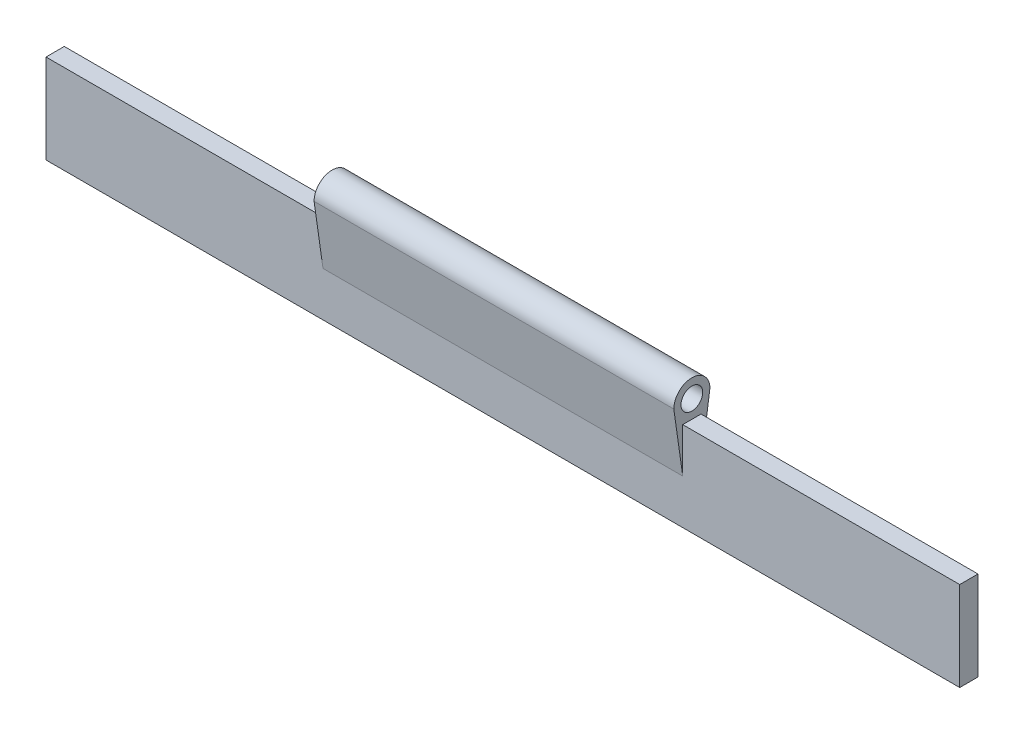
from build123d import *

# Parameters (mm, degrees)
SKETCH1_W           = 127
SKETCH1_H           = 12.4
BOSS_EXTRUDE1_DEPTH = 2.54
SKETCH2_R           = 1.51
BOSS_EXTRUDE3_DEPTH = 25
BOSS_EXTRUDE4_START = -25
SKETCH2_2_R         = 1.51
BOSS_EXTRUDE4_DEPTH = 25


with BuildPart() as part:
    # Sketch1 → Boss-Extrude1 (new body)
    with BuildSketch(Plane.XY):
        with Locations((0, 6.2)):
            Rectangle(SKETCH1_W, SKETCH1_H)
    extrude(amount=BOSS_EXTRUDE1_DEPTH)

    # Sketch2 → Boss-Extrude3 (add)
    with BuildSketch(Plane(origin=(0, 0, 0), x_dir=(0, 0, -1), z_dir=(1, 0, 0))):
        with BuildLine():
            Line((-2.54, 6.2), (-3.78, 14.9))
            ThreePointArc((-3.78, 14.9), (-1.27, 17.41), (1.24, 14.9))
            Line((1.24, 14.9), (0, 6.2))
            Line((0, 6.2), (-2.54, 6.2))
        make_face()
        with Locations((-1.27, 14.9)):
            Circle(SKETCH2_R, mode=Mode.SUBTRACT)
    extrude(amount=BOSS_EXTRUDE3_DEPTH)

    # Sketch2<2> → Boss-Extrude4 (add)
    with BuildSketch(Plane(origin=(0, 0, 0), x_dir=(0, 0, -1), z_dir=(1, 0, 0)).offset(BOSS_EXTRUDE4_START)):
        with BuildLine():
            Line((-2.54, 6.2), (-3.78, 14.9))
            ThreePointArc((-3.78, 14.9), (-1.27, 17.41), (1.24, 14.9))
            Line((1.24, 14.9), (0, 6.2))
            Line((0, 6.2), (-2.54, 6.2))
        make_face()
        with Locations((-1.27, 14.9)):
            Circle(SKETCH2_2_R, mode=Mode.SUBTRACT)
    extrude(amount=BOSS_EXTRUDE4_DEPTH)


solid = part.part
